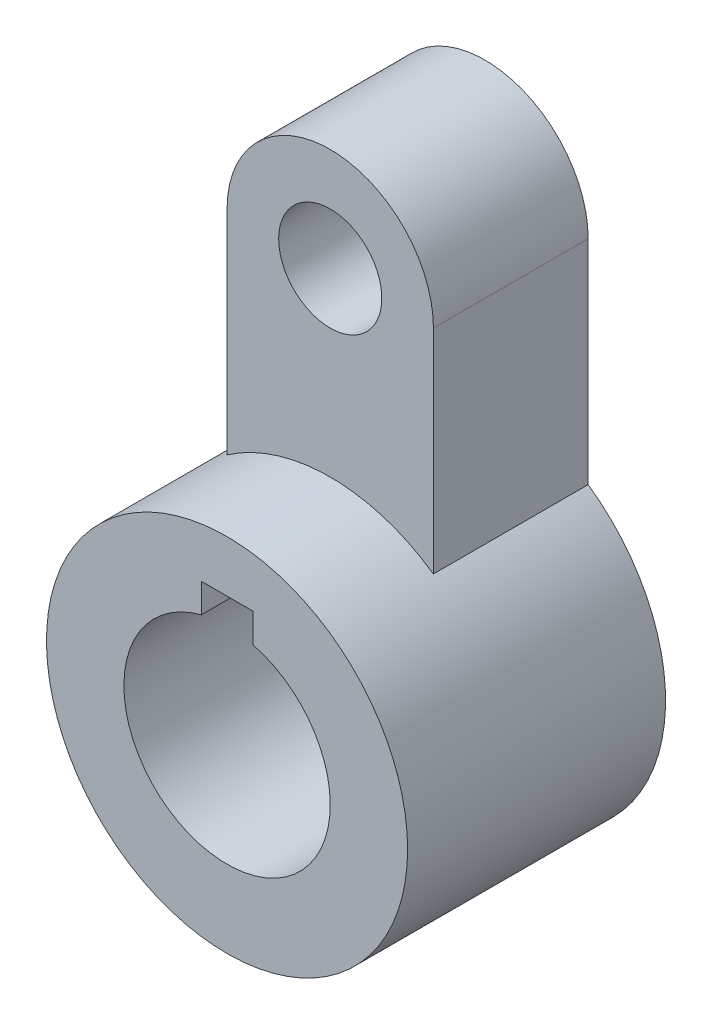
from build123d import *

# Parameters (mm, degrees)
BOSS_EXTRUDE1_DEPTH = 31.75
SKETCH1_3_R         = 6.35
BOSS_EXTRUDE2_DEPTH = 19.05
CUT_EXTRUDE1_DEPTH  = 70.051688068


with BuildPart() as part:
    # Sketch1 → Boss-Extrude1 (new body)
    with BuildSketch(Plane.XY):
        with BuildLine():
            ThreePointArc((12.7, 18.238986403), (0, 22.225), (-12.7, 18.238986403))
            ThreePointArc((-12.7, 18.238986403), (-10.288175859, -19.700356913), (22.225, 0))
            ThreePointArc((22.225, 0), (19.700356913, 10.288175859), (12.7, 18.238986403))
        make_face()
    extrude(amount=BOSS_EXTRUDE1_DEPTH)

    # Sketch1<3> → Boss-Extrude2 (add)
    with BuildSketch(Plane.XY):
        with BuildLine():
            ThreePointArc((12.7, 44.45), (0, 57.15), (-12.7, 44.45))
            Line((-12.7, 44.45), (-12.7, 18.238986403))
            ThreePointArc((-12.7, 18.238986403), (0, 22.225), (12.7, 18.238986403))
            Line((12.7, 18.238986403), (12.7, 44.45))
        make_face()
        with Locations((0, 44.45)):
            Circle(SKETCH1_3_R, mode=Mode.SUBTRACT)
    extrude(amount=BOSS_EXTRUDE2_DEPTH)

    # Sketch2 → Cut-Extrude1 (cut, through all)
    with BuildSketch(Plane.XY.offset(31.75)):
        with BuildLine():
            ThreePointArc((-3.175, 12.296722124), (0, -12.7), (3.175, 12.296722124))
            Line((3.175, 12.296722124), (3.175, 15.875))
            Line((3.175, 15.875), (-3.175, 15.875))
            Line((-3.175, 15.875), (-3.175, 12.296722124))
        make_face()
    extrude(amount=-CUT_EXTRUDE1_DEPTH, mode=Mode.SUBTRACT)


solid = part.part
